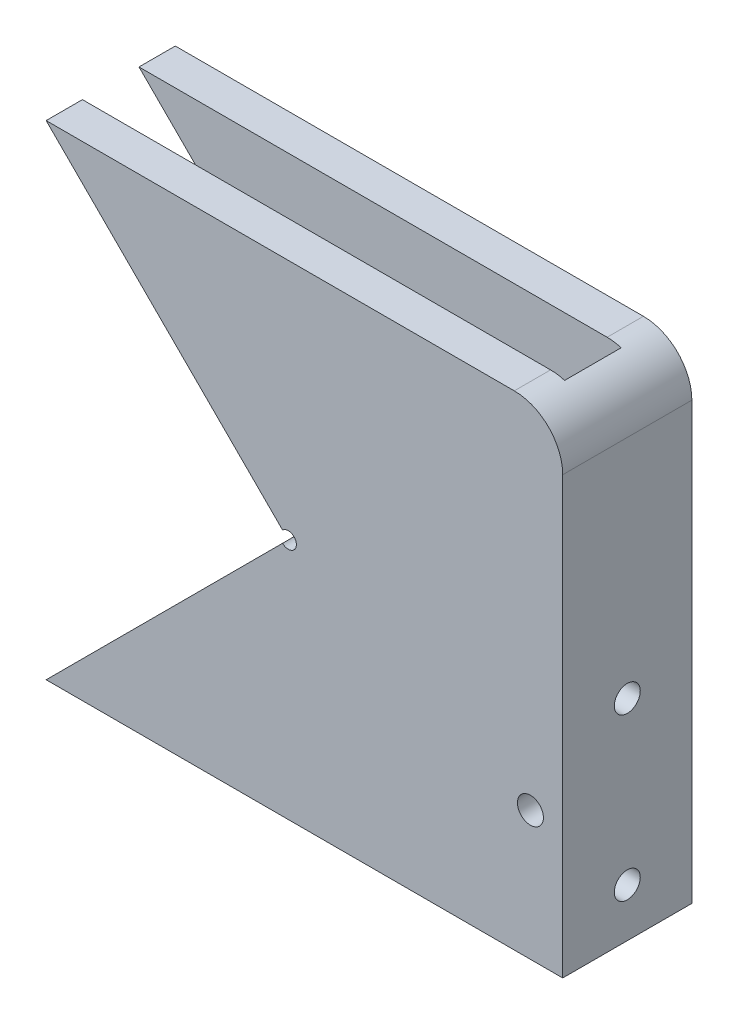
from build123d import *

# Parameters (mm, degrees)
BOSS_EXTRUDE1_DEPTH         = 12.7
SKETCH2_W                   = 11.1252
SKETCH2_H                   = 67.351920908
CUT_EXTRUDE1_DEPTH          = 83.336020747
FILLET1_R                   = 9.525
SKETCH3_R                   = 1.5875
CUT_EXTRUDE2_DEPTH          = 109.624912255
F_1_4_20_TAPPED_HOLE1_D     = 5.1054
F_1_4_20_TAPPED_HOLE2_D     = 5.1054
F_1_4_20_TAPPED_HOLE2_DEPTH = 15.875
F_1_4_20_TAPPED_HOLE2_TIP   = 1.533816902
F_1_4_20_TAPPED_HOLE3_D     = 5.1054


with BuildPart() as part:
    # Sketch1 → Boss-Extrude1 (new, symmetric)
    with BuildSketch(Plane.XY):
        Polygon((-23.8125, -23.8125), (77.7875, -23.8125), (77.7875, 23.8125), (23.8125, 23.8125), align=None)
    boss_extrude1 = extrude(amount=BOSS_EXTRUDE1_DEPTH, both=True)

    # Sketch2 → Cut-Extrude1 (cut, through all)
    with BuildSketch(Plane(origin=(0, 0, 0), x_dir=(0, 0, 1), z_dir=(-0.7071067811865441, 0.707106781186551, 0))):
        Rectangle(SKETCH2_W, SKETCH2_H)
    cut_extrude1 = extrude(amount=-CUT_EXTRUDE1_DEPTH, mode=Mode.SUBTRACT)

    # Mirror1: Boss-Extrude1, Cut-Extrude1 across plane
    add(boss_extrude1.mirror(Plane(origin=(77.7875, 23.8125, 12.7), x_dir=(0, 0, 1), z_dir=(0, -1, 0))))
    add(cut_extrude1.mirror(Plane(origin=(77.7875, 23.8125, 12.7), x_dir=(0, 0, 1), z_dir=(0, -1, 0))), mode=Mode.SUBTRACT)

    # Fillet1
    # the kernel refuses this fillet: 9.525 mm, written as the material it takes off along each edge
    with BuildSketch(Plane(origin=(77.7875, 71.4375, -36.5125), x_dir=(0, -1, 0), z_dir=(0, 0, 1))) as fillet1_piece_1:
        with BuildLine():
            CenterArc((FILLET1_R, -FILLET1_R), FILLET1_R, 90, 90)
            Line((0, -FILLET1_R), (0, 0))
            Line((0, 0), (FILLET1_R, 0))
        make_face()
    extrude(amount=73.025, mode=Mode.SUBTRACT)

    # Sketch3 → Cut-Extrude2 (cut, through all)
    with BuildSketch(Plane.XY.offset(12.7)):
        with Locations((23.8125, 23.8125)):
            Circle(SKETCH3_R)
    extrude(amount=-CUT_EXTRUDE2_DEPTH, mode=Mode.SUBTRACT)

    # 1/4-20 Tapped Hole1 (through all)
    with Locations(Plane.XY.offset(12.7)):
        with Locations((71.4375, 1.5875)):
            Hole(F_1_4_20_TAPPED_HOLE1_D / 2)

    # 1/4-20 Tapped Hole2
    with Locations(Plane(origin=(77.7875, 0, 0), x_dir=(0, 0, -1), z_dir=(1, 0, 0))):
        with Locations((0, 17.4625)):
            Hole(F_1_4_20_TAPPED_HOLE2_D / 2, depth=F_1_4_20_TAPPED_HOLE2_DEPTH)
            with Locations((0, 0, -(F_1_4_20_TAPPED_HOLE2_DEPTH + F_1_4_20_TAPPED_HOLE2_TIP / 2))):  # 118° drill point
                Cone(0, F_1_4_20_TAPPED_HOLE2_D / 2, F_1_4_20_TAPPED_HOLE2_TIP, mode=Mode.SUBTRACT)

    # 1/4-20 Tapped Hole3 (through all)
    with Locations(Plane(origin=(77.7875, 0, 0), x_dir=(0, 0, -1), z_dir=(1, 0, 0))):
        with Locations((0, -14.2875)):
            Hole(F_1_4_20_TAPPED_HOLE3_D / 2)


solid = part.part
